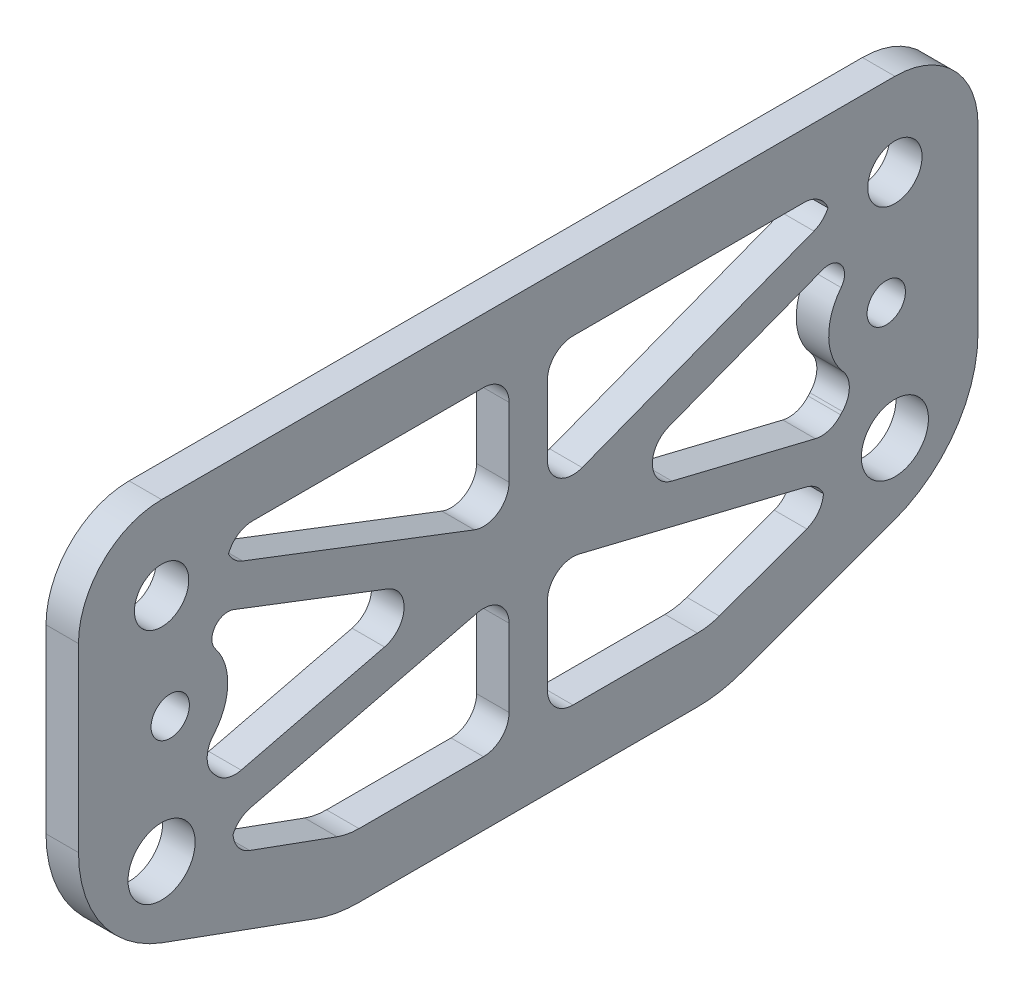
from build123d import *

# Parameters (mm, degrees)
SKETCH1_R           = 2.125
SKETCH1_R_2         = 1.5
SKETCH1_R_3         = 2.625
BOSS_EXTRUDE1_DEPTH = 2.54
FILLET1_R           = 10
CUT_EXTRUDE2_DEPTH  = 40.369813627
FILLET2_R           = 2


with BuildPart() as part:
    # Sketch1 → Boss-Extrude1 (new body)
    with BuildSketch(Plane(origin=(0, 0, 0), x_dir=(0, 0, -1), z_dir=(1, 0, 0))):
        with BuildLine():
            Line((15, 17.5), (28.675, 17.5))
            ThreePointArc((28.675, 17.5), (33.271194078, 15.596194078), (35.175, 11))
            Line((35.175, 11), (35.175, -3.154825142))
            ThreePointArc((35.175, -3.154825142), (33.366520443, -8.890589505), (28.595201433, -12.551751349))
            Line((28.595201433, -12.551751349), (15, -17.5))
            Line((15, -17.5), (-15, -17.5))
            Line((-15, -17.5), (-28.595201433, -12.551751349))
            ThreePointArc((-28.595201433, -12.551751349), (-33.366520443, -8.890589505), (-35.175, -3.154825142))
            Line((-35.175, -3.154825142), (-35.175, 11))
            ThreePointArc((-35.175, 11), (-33.271194078, 15.596194078), (-28.675, 17.5))
            Line((-28.675, 17.5), (-15, 17.5))
            Line((-15, 17.5), (15, 17.5))
        make_face()
        with Locations((28.675, 11)):
            Circle(SKETCH1_R, mode=Mode.SUBTRACT)
        with Locations(Location((-28.675, 11, 0), (0, 0, 180))):
            Circle(SKETCH1_R, mode=Mode.SUBTRACT)
        with Locations((28, 2.5)):
            Circle(SKETCH1_R_2, mode=Mode.SUBTRACT)
        with Locations(Location((-28, 2.5, 0), (0, 0, 180))):
            Circle(SKETCH1_R_2, mode=Mode.SUBTRACT)
        with Locations((28.675, -7)):
            Circle(SKETCH1_R_3, mode=Mode.SUBTRACT)
        with Locations(Location((-28.675, -7, 0), (0, 0, 180))):
            Circle(SKETCH1_R_3, mode=Mode.SUBTRACT)
    extrude(amount=BOSS_EXTRUDE1_DEPTH)

    # Fillet1
    fillet1_edges = [part.edges().sort_by_distance(p)[0] for p in [
        (1.27, -17.5, -15),
        (1.27, -17.5, 15),
    ]]
    fillet(fillet1_edges, radius=FILLET1_R)

    # Sketch2 → Cut-Extrude2 (cut, through all)
    with BuildSketch(Plane(origin=(0, 0, 0), x_dir=(0, 0, -1), z_dir=(1, 0, 0))):
        with BuildLine():
            ThreePointArc((-23.774426054, 12.5), (-23.583197925, 11.582388729), (-23.562289313, 10.645296699))
            Line((-23.562289313, 10.645296699), (-1.5, 2.181994783))
            Line((-1.5, 2.181994783), (-1.5, 12.5))
            Line((-1.5, 12.5), (-23.774426054, 12.5))
        make_face()
        with BuildLine():
            ThreePointArc((-23.040869369, 7.232113781), (-24.495524174, 6.805676348), (-24.469315886, 5.29003041))
            ThreePointArc((-24.469315886, 5.29003041), (-23.690537785, 1.204416959), (-26.593153981, -1.774433796))
            ThreePointArc((-26.593153981, -1.774433796), (-24.964789293, -2.77212092), (-23.764069674, -4.257120431))
            Line((-23.764069674, -4.257120431), (-5.019125542, 0.318803158))
            Line((-5.019125542, 0.318803158), (-23.040869369, 7.232113781))
        make_face()
        with BuildLine():
            Line((23.774426054, 12.5), (1.5, 12.5))
            Line((1.5, 12.5), (1.5, 2.181994783))
            Line((1.5, 2.181994783), (23.562289313, 10.645296699))
            ThreePointArc((23.562289313, 10.645296699), (23.583197925, 11.582388729), (23.774426054, 12.5))
        make_face()
        with BuildLine():
            Line((-1.5, -12.5), (-1.5, -1.91022003))
            Line((-1.5, -1.91022003), (-23.052616211, -7.171538721))
            ThreePointArc((-23.052616211, -7.171538721), (-23.169671761, -8.15411697), (-23.457097153, -9.100979506))
            Line((-23.457097153, -9.100979506), (-14.94683091, -12.198463104))
            ThreePointArc((-14.94683091, -12.198463104), (-14.104971081, -12.424038765), (-13.236730193, -12.5))
            Line((-13.236730193, -12.5), (-1.5, -12.5))
        make_face()
        with BuildLine():
            Line((23.052616211, -7.171538721), (1.5, -1.91022003))
            Line((1.5, -1.91022003), (1.5, -12.5))
            Line((1.5, -12.5), (13.236730193, -12.5))
            ThreePointArc((13.236730193, -12.5), (14.104971081, -12.424038765), (14.94683091, -12.198463104))
            Line((14.94683091, -12.198463104), (23.457097153, -9.100979506))
            ThreePointArc((23.457097153, -9.100979506), (23.169671761, -8.15411697), (23.052616211, -7.171538721))
        make_face()
        with BuildLine():
            Line((23.040869369, 7.232113781), (5.019125542, 0.318803158))
            Line((5.019125542, 0.318803158), (23.764069674, -4.257120431))
            ThreePointArc((23.764069674, -4.257120431), (24.964789293, -2.77212092), (26.593153981, -1.774433796))
            ThreePointArc((26.593153981, -1.774433796), (23.690537785, 1.204416959), (24.469315886, 5.29003041))
            ThreePointArc((24.469315886, 5.29003041), (24.495524174, 6.805676348), (23.040869369, 7.232113781))
        make_face()
    extrude(amount=CUT_EXTRUDE2_DEPTH, mode=Mode.SUBTRACT)

    # Fillet2
    # the kernel refuses this fillet: 2 mm, written as the material it adds along each edge
    with BuildSketch(Plane(origin=(0, -12.5, -1.5), x_dir=(0, 0, -1), z_dir=(1, 0, 0)), Plane(origin=(0, 12.5, -1.5), x_dir=(0, -1, 0), z_dir=(1, 0, 0))) as fillet2_piece_1:
        with BuildLine():
            CenterArc((FILLET2_R, FILLET2_R), FILLET2_R, 180, 90)
            Line((0, FILLET2_R), (0, 0))
            Line((0, 0), (FILLET2_R, 0))
        make_face()
    extrude(amount=2.54)
    with BuildSketch(Plane(origin=(0, -12.5, 1.5), x_dir=(0, 0, 1), z_dir=(1, 0, 0)), Plane(origin=(0, 12.5, 1.5), x_dir=(0, -1, 0), z_dir=(1, 0, 0))) as fillet2_piece_2:
        with BuildLine():
            CenterArc((FILLET2_R, -FILLET2_R), FILLET2_R, 90, 90)
            Line((0, -FILLET2_R), (0, 0))
            Line((0, 0), (FILLET2_R, 0))
        make_face()
    extrude(amount=2.54)
    with BuildSketch(Plane(origin=(0, -1.91022003, -1.5), x_dir=(0, -1, 0), z_dir=(1, 0, 0)), Plane(origin=(0, -1.91022003, 1.5), x_dir=(0, -0.23715115410902912, 0.9714727634394881), z_dir=(1, 0, 0))) as fillet2_piece_3:
        with BuildLine():
            CenterArc((FILLET2_R * 1.27348001989, FILLET2_R), FILLET2_R, 166.281540054, 103.718459946)
            Line((FILLET2_R * 0.302007256452, FILLET2_R * 1.23715115411), (0, 0))
            Line((0, 0), (FILLET2_R * 1.27348001989, 0))
        make_face()
    extrude(amount=2.54)
    with BuildSketch(Plane(origin=(0, -9.100979506, -23.457097153), x_dir=(0, 0.9698771558526914, 0.24359454541326273), z_dir=(1, 0, 0))) as fillet2_piece_4:
        with BuildLine():
            CenterArc((1.805861593, 1.981337572), FILLET2_R, 185.90120906, 76.265486652)
            Line((-0.183539703, 1.775710517), (0, 0))
            ThreePointArc((0, 0), (0.766639355, 0.05248808), (1.533278711, 0))
        make_face()
    extrude(amount=2.54)
    with BuildSketch(Plane(origin=(0, -7.171538721, -23.052616211), x_dir=(0, -0.991038367867246, -0.13357751837425885), z_dir=(1, 0, 0)), Plane(origin=(0, -4.257120431, 23.764069674), x_dir=(0, 0.8180162943485203, 0.5751950470756115), z_dir=(1, 0, 0))) as fillet2_piece_5:
        with BuildLine():
            CenterArc((1.368631059, -1.989301963), FILLET2_R, 95.928822705, 62.676344636)
            Line((-0.493546379, -1.259716335), (0, 0))
            ThreePointArc((0, 0), (0.581022619, -0.03008823), (1.162045239, 0))
        make_face()
    extrude(amount=2.54)
    with BuildSketch(Plane(origin=(0, 2.181994783, -1.5), x_dir=(0, 0.3581607437996355, -0.9336599389504147), z_dir=(1, 0, 0)), Plane(origin=(0, 2.181994783, 1.5), x_dir=(0, 1, 0), z_dir=(1, 0, 0))) as fillet2_piece_6:
        with BuildLine():
            CenterArc((FILLET2_R * 1.45466318853, FILLET2_R), FILLET2_R, 159.012716108, 110.987283892)
            Line((FILLET2_R * 0.521003249583, FILLET2_R * 1.3581607438), (0, 0))
            Line((0, 0), (FILLET2_R * 1.45466318853, 0))
        make_face()
    extrude(amount=2.54)
    with BuildSketch(Plane(origin=(0, 10.645296699, -23.562289313), x_dir=(0, -0.3581607437996529, 0.9336599389504079), z_dir=(1, 0, 0))) as fillet2_piece_7:
        with BuildLine():
            CenterArc((1.305521848, -2), FILLET2_R, 90, 60.578668933)
            ThreePointArc((-0.436540129, -1.01754386), (-0.190709987, -0.520595577), (0, 0))
            Line((0, 0), (1.305521848, 0))
        make_face()
    extrude(amount=2.54)
    with BuildSketch(Plane(origin=(0, 12.5, -23.774426054), x_dir=(0, 0, 1), z_dir=(1, 0, 0))) as fillet2_piece_8:
        with BuildLine():
            CenterArc((2.206860542, 2), FILLET2_R, 184.024063889, 85.975936111)
            ThreePointArc((0.211791212, 1.859649123), (0.191509232, 0.92007422), (0, 0))
            Line((0, 0), (2.206860542, 0))
        make_face()
    extrude(amount=2.54)
    with BuildSketch(Plane(origin=(0, -7.171538721, 23.052616211), x_dir=(0, -0.9910383678672416, 0.13357751837428994), z_dir=(1, 0, 0))) as fillet2_piece_9:
        with BuildLine():
            CenterArc((1.368631059, 1.989301963), FILLET2_R, 201.394832659, 62.676344636)
            Line((-0.493546379, 1.259716335), (0, 0))
            ThreePointArc((0, 0), (0.581022619, 0.03008823), (1.162045239, 0))
        make_face()
    extrude(amount=2.54)
    with BuildSketch(Plane(origin=(0, -9.100979506, 23.457097153), x_dir=(0, -0.342020143325639, -0.9396926207859192), z_dir=(1, 0, 0))) as fillet2_piece_10:
        with BuildLine():
            CenterArc((1.785170766, 2), FILLET2_R, 193.734513348, 76.265486652)
            ThreePointArc((-0.157641792, 1.525153327), (-0.026610969, 0.767973148), (0, 0))
            Line((0, 0), (1.785170766, 0))
        make_face()
    extrude(amount=2.54)
    with BuildSketch(Plane(origin=(0, 0.318803158, -5.019125542), x_dir=(0, -0.23715115410902946, -0.971472763439488), z_dir=(1, 0, 0)), Plane(origin=(0, 0.318803158, 5.019125542), x_dir=(0, 0.3581607437996354, 0.9336599389504147), z_dir=(1, 0, 0))) as fillet2_piece_11:
        with BuildLine():
            CenterArc((FILLET2_R * 3.20022614882, FILLET2_R), FILLET2_R, 124.705743839, 145.294256161)
            Line((FILLET2_R * 2.63086420922, FILLET2_R * 1.82208696726), (0, 0))
            Line((0, 0), (FILLET2_R * 3.20022614882, 0))
        make_face()
    extrude(amount=2.54)
    with BuildSketch(Plane(origin=(0, -4.257120431, -23.764069674), x_dir=(0, 0.23715115410907214, 0.9714727634394775), z_dir=(1, 0, 0))) as fillet2_piece_12:
        with BuildLine():
            CenterArc((1.352949842, -2), FILLET2_R, 90, 62.676344636)
            ThreePointArc((-0.423905752, -1.081967213), (-0.183938065, -0.551959577), (0, 0))
            Line((0, 0), (1.352949842, 0))
        make_face()
    extrude(amount=2.54)
    with BuildSketch(Plane(origin=(0, -1.774433796, -26.593153981), x_dir=(0, 0.5517747839578403, 0.8339931581183857), z_dir=(1, 0, 0))) as fillet2_piece_13:
        with BuildLine():
            CenterArc((2.89721625, 1.929382533), FILLET2_R, 170.336114641, 84.3929753)
            ThreePointArc((0.925597299, 2.265118609), (0.587459761, 1.081618931), (0, 0))
            ThreePointArc((0, 0), (1.18522483, 0.158889301), (2.370449659, 0))
        make_face()
    extrude(amount=2.54)
    with BuildSketch(Plane(origin=(0, -1.774433796, 26.593153981), x_dir=(0, -0.5633055097989954, -0.826248692967253), z_dir=(1, 0, 0))) as fillet2_piece_14:
        with BuildLine():
            CenterArc((2.881946095, 1.95211825), FILLET2_R, 173.04447146, 84.3929753)
            ThreePointArc((0.896665206, 2.194316088), (0.595415815, 1.037055309), (0, 0))
            ThreePointArc((0, 0), (1.223467682, 0.134667421), (2.446935364, 0))
        make_face()
    extrude(amount=2.54)
    with BuildSketch(Plane(origin=(0, 12.5, 23.774426054), x_dir=(0, -0.9935772054285649, -0.11315624972913957), z_dir=(1, 0, 0))) as fillet2_piece_15:
        with BuildLine():
            CenterArc((2.236874473, 1.966373831), FILLET2_R, 173.502708243, 85.975936111)
            Line((0.249720063, 2.19268633), (0, 0))
            ThreePointArc((0, 0), (0.935835239, 0.086167059), (1.871670478, 0))
        make_face()
    extrude(amount=2.54)
    with BuildSketch(Plane(origin=(0, 10.645296699, 23.562289313), x_dir=(0, -0.35816074379962426, -0.9336599389504189), z_dir=(1, 0, 0))) as fillet2_piece_16:
        with BuildLine():
            CenterArc((1.305521848, 2), FILLET2_R, 209.421331067, 60.578668933)
            ThreePointArc((-0.436540129, 1.01754386), (-0.190709987, 0.520595577), (0, 0))
            Line((0, 0), (1.305521848, 0))
        make_face()
    extrude(amount=2.54)


solid = part.part
